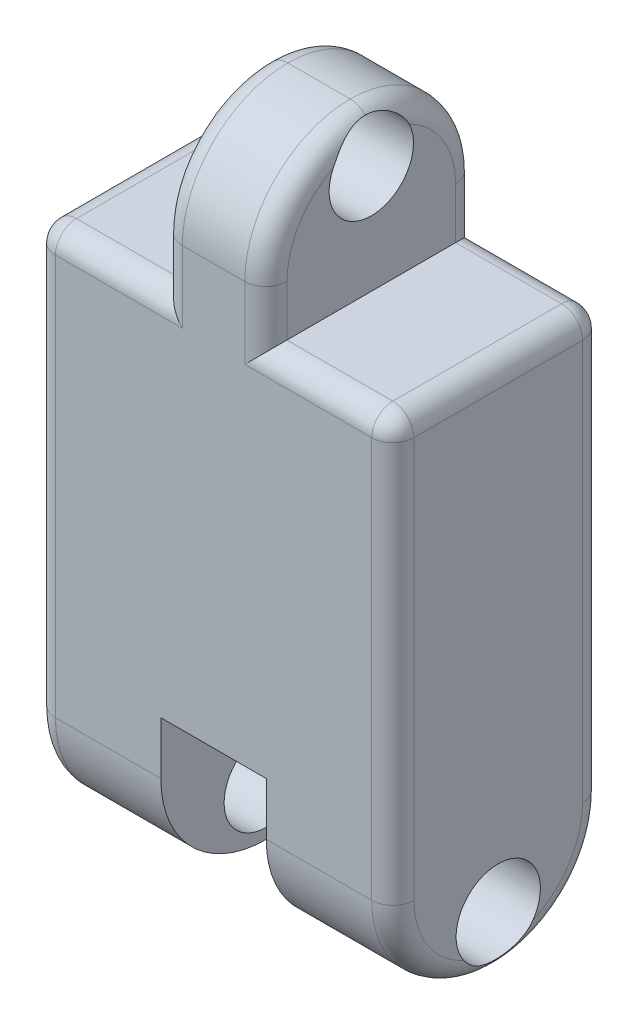
from build123d import *

# Parameters (mm, degrees)
BOSS_EXTRUDE1_DEPTH    = 100
SKETCH2_W              = 50
SKETCH2_H              = 50
CUT_EXTRUDE1_DEPTH     = 239.382046304
FILLET1_R              = 50
CUT_EXTRUDE2_DEPTH     = 25
SKETCH7_R              = 20
CUT_EXTRUDE3_DEPTH     = 281.180299093
FILLET2_R              = 50
CUT_EXTRUDE6_START     = -125
CUT_EXTRUDE6_OUTLINE_W = 50
CUT_EXTRUDE6_OUTLINE_H = 6.698729811
CUT_EXTRUDE6_DEPTH     = 50
CUT_EXTRUDE7_DEPTH     = 25
FILLET3_R              = 10
SKETCH11_W             = 50
SKETCH11_H             = 25
CUT_EXTRUDE8_DEPTH     = 99
BOSS_EXTRUDE7_DEPTH    = 0.1
FILLET4_R              = 10
FILLET5_R              = 10
SKETCH14_R             = 20
CUT_EXTRUDE9_DEPTH     = 249.348646185


with BuildPart() as part:
    # Sketch1 → Boss-Extrude1 (new body)
    with BuildSketch(Plane.XY):
        Polygon((-24.8, 125), (-24.8, 199), (24.8, 199), (24.8, 125), (85, 125), (85, -125), (-85, -125), (-85, 125), align=None)
    extrude(amount=-BOSS_EXTRUDE1_DEPTH)

    # Sketch2 → Cut-Extrude1 (cut, through all)
    with BuildSketch(Plane.XY):
        with Locations((0, -125)):
            Rectangle(SKETCH2_W, SKETCH2_H)
    extrude(amount=-CUT_EXTRUDE1_DEPTH, mode=Mode.SUBTRACT)

    # Fillet1
    fillet1_edges = [part.edges().sort_by_distance(p)[0] for p in [
        (0, 199, -100),
        (0, 199, 0),
    ]]
    fillet(fillet1_edges, radius=FILLET1_R - 0.0001)  # a hair under: the kernel refuses the full size

    # Sketch6 → Cut-Extrude2 (cut, symmetric)
    with BuildSketch(Plane(origin=(0, 0, 0), x_dir=(0, 0, -1), z_dir=(1, 0, 0))):
        with BuildLine():
            Line((100, -100), (0, -100))
            ThreePointArc((0, -100), (50, -50), (100, -100))
        make_face()
    extrude(amount=CUT_EXTRUDE2_DEPTH, both=True, mode=Mode.SUBTRACT)

    # Sketch7 → Cut-Extrude3 (cut, through all)
    with BuildSketch(Plane.ZY.offset(85)):
        with Locations(Location((-50, -100, 0), (0, 0, 270))):
            Circle(SKETCH7_R)
    extrude(amount=-CUT_EXTRUDE3_DEPTH, mode=Mode.SUBTRACT)

    # Fillet2
    fillet2_edges = [part.edges().sort_by_distance(p)[0] for p in [
        (-55, -125, -100),
        (-55, -125, 0),
    ]]
    fillet(fillet2_edges, radius=FILLET2_R - 0.0001)  # a hair under: the kernel refuses the full size

    # Cut-Extrude6: read off the stored shape, not the designer's step
    # Cut-Extrude6 outline → Cut-Extrude6 (cut)
    with BuildSketch(Plane(origin=(0, 0, 0), x_dir=(1, 0, 0), z_dir=(0, 1, 0)).offset(CUT_EXTRUDE6_START)):
        with Locations((0, 96.650635095)):
            Rectangle(CUT_EXTRUDE6_OUTLINE_W, CUT_EXTRUDE6_OUTLINE_H)
        with Locations((0, 3.349364906)):
            Rectangle(CUT_EXTRUDE6_OUTLINE_W, CUT_EXTRUDE6_OUTLINE_H)
    extrude(amount=CUT_EXTRUDE6_DEPTH, mode=Mode.SUBTRACT)

    # Sketch10 → Cut-Extrude7 (cut, symmetric)
    with BuildSketch(Plane(origin=(0, 0, 0), x_dir=(0, 0, -1), z_dir=(1, 0, 0))):
        with BuildLine():
            Line((0, -75), (100, -75))
            ThreePointArc((100, -75), (50, -61.611517322), (0, -75))
        make_face()
    extrude(amount=CUT_EXTRUDE7_DEPTH, both=True, mode=Mode.SUBTRACT)

    # Fillet3
    # the kernel refuses this fillet: 10 mm, written as the material it takes off along each edge
    with BuildSketch(Plane(origin=(24.8, 149.0001, -100), x_dir=(0, 0, 1), z_dir=(0, -1, 0)), Plane(origin=(-24.8, 125, 0), x_dir=(1, 0, 0), z_dir=(0, 1, 0)), Plane(origin=(-24.8, 125, -100), x_dir=(0, 0, 1), z_dir=(0, 1, 0)), Plane(origin=(24.8, 149.0001, 0), x_dir=(-1, 0, 0), z_dir=(0, -1, 0))) as fillet3_piece_1:
        with BuildLine():
            CenterArc((FILLET3_R, FILLET3_R), FILLET3_R, 180, 90)
            Line((0, FILLET3_R), (0, 0))
            Line((0, 0), (FILLET3_R, 0))
        make_face()
    extrude(amount=24.0001, mode=Mode.SUBTRACT)
    with BuildSketch(Plane(origin=(24.8, 125, 0), x_dir=(0, -1, 0), z_dir=(1, 0, 0)), Plane(origin=(-110, 125, -100), x_dir=(0, 0, 1), z_dir=(1, 0, 0)), Plane(origin=(24.8, 125, -100), x_dir=(0, 0, 1), z_dir=(1, 0, 0)), Plane(origin=(-110, 125, 0), x_dir=(0, -1, 0), z_dir=(1, 0, 0))) as fillet3_piece_2:
        with BuildLine():
            CenterArc((FILLET3_R, FILLET3_R), FILLET3_R, 180, 90)
            Line((0, FILLET3_R), (0, 0))
            Line((0, 0), (FILLET3_R, 0))
        make_face()
    extrude(amount=85.2, mode=Mode.SUBTRACT)
    with BuildSketch(Plane(origin=(-85, -75.0001, -100), x_dir=(0, 0, 1), z_dir=(0, 1, 0)), Plane(origin=(85, 150, 0), x_dir=(-1, 0, 0), z_dir=(0, -1, 0)), Plane(origin=(85, 150, -100), x_dir=(0, 0, 1), z_dir=(0, -1, 0)), Plane(origin=(-85, -75.0001, 0), x_dir=(1, 0, 0), z_dir=(0, 1, 0))) as fillet3_piece_3:
        with BuildLine():
            CenterArc((FILLET3_R, FILLET3_R), FILLET3_R, 180, 90)
            Line((0, FILLET3_R), (0, 0))
            Line((0, 0), (FILLET3_R, 0))
        make_face()
    extrude(amount=225.0001, mode=Mode.SUBTRACT)
    with BuildSketch(Plane(origin=(-24.8, 149.0001, -49.9999), x_dir=(0, 1, 0), z_dir=(0, 0, -1))) as fillet3_piece_4:
        with BuildLine():
            CenterArc((49.9999 - FILLET3_R, FILLET3_R), FILLET3_R, 270, 90)
            Line((49.9999 - FILLET3_R, 0), (49.9999, 0))
            Line((49.9999, 0), (49.9999, FILLET3_R))
        make_face()
    revolve(axis=Axis((-24.8, 149.0001, -49.9999), (1, 0, 0)), revolution_arc=90, mode=Mode.SUBTRACT)
    with BuildSketch(Plane(origin=(-24.8, 149.0001, -50.0001), x_dir=(0, 1, 0), z_dir=(0, 0, 1))) as fillet3_piece_5:
        with BuildLine():
            CenterArc((49.9999 - FILLET3_R, -FILLET3_R), FILLET3_R, 0, 90)
            Line((49.9999, -FILLET3_R), (49.9999, 0))
            Line((49.9999, 0), (49.9999 - FILLET3_R, 0))
        make_face()
    revolve(axis=Axis((-24.8, 149.0001, -50.0001), (-1, 0, 0)), revolution_arc=90, mode=Mode.SUBTRACT)
    with BuildSketch(Plane(origin=(24.8, 149.0001, -49.9999), x_dir=(0, 1, 0), z_dir=(0, 0, -1))) as fillet3_piece_6:
        with BuildLine():
            CenterArc((49.9999 - FILLET3_R, -FILLET3_R), FILLET3_R, 0, 90)
            Line((49.9999, -FILLET3_R), (49.9999, 0))
            Line((49.9999, 0), (49.9999 - FILLET3_R, 0))
        make_face()
    revolve(axis=Axis((24.8, 149.0001, -49.9999), (1, 0, 0)), revolution_arc=90, mode=Mode.SUBTRACT)
    with BuildSketch(Plane(origin=(24.8, 149.0001, -50.0001), x_dir=(0, 1, 0), z_dir=(0, 0, 1))) as fillet3_piece_7:
        with BuildLine():
            CenterArc((49.9999 - FILLET3_R, FILLET3_R), FILLET3_R, 270, 90)
            Line((49.9999, FILLET3_R), (49.9999, 0))
            Line((49.9999, 0), (49.9999 - FILLET3_R, 0))
        make_face()
    revolve(axis=Axis((24.8, 149.0001, -50.0001), (-1, 0, 0)), revolution_arc=90, mode=Mode.SUBTRACT)
    with BuildSketch(Plane(origin=(85, -75.0001, -49.9999), x_dir=(0, 0, 1), z_dir=(0, 1, 0))) as fillet3_piece_8:
        with BuildLine():
            CenterArc((49.9999 - FILLET3_R, -FILLET3_R), FILLET3_R, 360, 90)
            Line((49.9999, -FILLET3_R), (49.9999, 0))
            Line((49.9999, 0), (49.9999 - FILLET3_R, 0))
        make_face()
    revolve(axis=Axis((85, -75.0001, -49.9999), (1, 0, 0)), revolution_arc=90, mode=Mode.SUBTRACT)
    with BuildSketch(Plane(origin=(85, -75.0001, -50.0001), x_dir=(0, 0, -1), z_dir=(0, 1, 0))) as fillet3_piece_9:
        with BuildLine():
            CenterArc((49.9999 - FILLET3_R, FILLET3_R), FILLET3_R, 270, 90)
            Line((49.9999, FILLET3_R), (49.9999, 0))
            Line((49.9999, 0), (49.9999 - FILLET3_R, 0))
        make_face()
    revolve(axis=Axis((85, -75.0001, -50.0001), (-1, 0, 0)), revolution_arc=90, mode=Mode.SUBTRACT)
    with BuildSketch(Plane(origin=(-85, -75.0001, -49.9999), x_dir=(0, 0, 1), z_dir=(0, 1, 0))) as fillet3_piece_10:
        with BuildLine():
            CenterArc((49.9999 - FILLET3_R, FILLET3_R), FILLET3_R, 270, 90)
            Line((49.9999, FILLET3_R), (49.9999, 0))
            Line((49.9999, 0), (49.9999 - FILLET3_R, 0))
        make_face()
    revolve(axis=Axis((-85, -75.0001, -49.9999), (1, 0, 0)), revolution_arc=90, mode=Mode.SUBTRACT)
    with BuildSketch(Plane(origin=(-85, -75.0001, -50.0001), x_dir=(0, 0, -1), z_dir=(0, 1, 0))) as fillet3_piece_11:
        with BuildLine():
            CenterArc((49.9999 - FILLET3_R, -FILLET3_R), FILLET3_R, 0, 90)
            Line((49.9999, -FILLET3_R), (49.9999, 0))
            Line((49.9999, 0), (49.9999 - FILLET3_R, 0))
        make_face()
    revolve(axis=Axis((-85, -75.0001, -50.0001), (-1, 0, 0)), revolution_arc=90, mode=Mode.SUBTRACT)
    with BuildSketch(Plane(origin=(-85, -125, -49.9999), x_dir=(0, 1, 0), z_dir=(0, 0, -1)), Plane(origin=(24.8, 199, -49.9999), x_dir=(0, -1, 0), z_dir=(0, 0, -1))) as fillet3_piece_12:
        with BuildLine():
            CenterArc((FILLET3_R, FILLET3_R), FILLET3_R, 180, 90)
            Line((0, FILLET3_R), (0, 0))
            Line((0, 0), (FILLET3_R, 0))
        make_face()
    extrude(amount=0.0002, mode=Mode.SUBTRACT)
    with BuildSketch(Plane(origin=(85, -125, -49.9999), x_dir=(0, 1, 0), z_dir=(0, 0, -1)), Plane(origin=(-24.8, 199, -49.9999), x_dir=(0, -1, 0), z_dir=(0, 0, -1))) as fillet3_piece_13:
        with BuildLine():
            CenterArc((FILLET3_R, -FILLET3_R), FILLET3_R, 90, 90)
            Line((0, -FILLET3_R), (0, 0))
            Line((0, 0), (FILLET3_R, 0))
        make_face()
    extrude(amount=0.0002, mode=Mode.SUBTRACT)
    with BuildSketch(Plane(origin=(-0.2, 125, -100), x_dir=(0, 0, 1), z_dir=(1, 0, 0))) as fillet3_piece_14a_section:
        with BuildLine():
            CenterArc((FILLET3_R, FILLET3_R), FILLET3_R, 180, 90)
            Line((0, FILLET3_R), (0, 0))
            Line((0, 0), (FILLET3_R, 0))
        make_face()
    fillet3_piece_14a = extrude(amount=110.2, mode=Mode.PRIVATE)
    fillet3_piece_14a = split(fillet3_piece_14a, bisect_by=Plane(origin=(24.8, 125, -100), z_dir=(-1, 0, 0)), keep=Keep.TOP, mode=Mode.PRIVATE)
    with BuildSketch(Plane(origin=(24.8, 149.0001, -100), x_dir=(0, 0, 1), z_dir=(0, -1, 0))) as fillet3_piece_14b_section:
        with BuildLine():
            CenterArc((FILLET3_R, FILLET3_R), FILLET3_R, 180, 90)
            Line((0, FILLET3_R), (0, 0))
            Line((0, 0), (FILLET3_R, 0))
        make_face()
    fillet3_piece_14b = extrude(amount=49.0001, mode=Mode.PRIVATE)
    fillet3_piece_14b = split(fillet3_piece_14b, bisect_by=Plane(origin=(24.8, 125, -100), z_dir=(0, -1, 0)), keep=Keep.TOP, mode=Mode.PRIVATE)
    fillet3_piece_14 = fillet3_piece_14a & fillet3_piece_14b
    add(fillet3_piece_14, mode=Mode.SUBTRACT)
    with BuildSketch(Plane(origin=(-0.2, 125, 0), x_dir=(0, -1, 0), z_dir=(1, 0, 0))) as fillet3_piece_15a_section:
        with BuildLine():
            CenterArc((FILLET3_R, FILLET3_R), FILLET3_R, 180, 90)
            Line((0, FILLET3_R), (0, 0))
            Line((0, 0), (FILLET3_R, 0))
        make_face()
    fillet3_piece_15a = extrude(amount=110.2, mode=Mode.PRIVATE)
    fillet3_piece_15a = split(fillet3_piece_15a, bisect_by=Plane(origin=(24.8, 125, 0), z_dir=(-1, 0, 0)), keep=Keep.TOP, mode=Mode.PRIVATE)
    with BuildSketch(Plane(origin=(24.8, 149.0001, 0), x_dir=(-1, 0, 0), z_dir=(0, -1, 0))) as fillet3_piece_15b_section:
        with BuildLine():
            CenterArc((FILLET3_R, FILLET3_R), FILLET3_R, 180, 90)
            Line((0, FILLET3_R), (0, 0))
            Line((0, 0), (FILLET3_R, 0))
        make_face()
    fillet3_piece_15b = extrude(amount=49.0001, mode=Mode.PRIVATE)
    fillet3_piece_15b = split(fillet3_piece_15b, bisect_by=Plane(origin=(24.8, 125, 0), z_dir=(0, -1, 0)), keep=Keep.TOP, mode=Mode.PRIVATE)
    fillet3_piece_15 = fillet3_piece_15a & fillet3_piece_15b
    add(fillet3_piece_15, mode=Mode.SUBTRACT)
    with BuildSketch(Plane(origin=(-24.8, 100, -100), x_dir=(0, 0, 1), z_dir=(0, 1, 0))) as fillet3_piece_16a_section:
        with BuildLine():
            CenterArc((FILLET3_R, FILLET3_R), FILLET3_R, 180, 90)
            Line((0, FILLET3_R), (0, 0))
            Line((0, 0), (FILLET3_R, 0))
        make_face()
    fillet3_piece_16a = extrude(amount=49.0001, mode=Mode.PRIVATE)
    fillet3_piece_16a = split(fillet3_piece_16a, bisect_by=Plane(origin=(-24.8, 125, -100), z_dir=(0, -1, 0)), keep=Keep.TOP, mode=Mode.PRIVATE)
    with BuildSketch(Plane(origin=(-110, 125, -100), x_dir=(0, 0, 1), z_dir=(1, 0, 0))) as fillet3_piece_16b_section:
        with BuildLine():
            CenterArc((FILLET3_R, FILLET3_R), FILLET3_R, 180, 90)
            Line((0, FILLET3_R), (0, 0))
            Line((0, 0), (FILLET3_R, 0))
        make_face()
    fillet3_piece_16b = extrude(amount=110.2, mode=Mode.PRIVATE)
    fillet3_piece_16b = split(fillet3_piece_16b, bisect_by=Plane(origin=(-24.8, 125, -100), z_dir=(1, 0, 0)), keep=Keep.TOP, mode=Mode.PRIVATE)
    fillet3_piece_16 = fillet3_piece_16a & fillet3_piece_16b
    add(fillet3_piece_16, mode=Mode.SUBTRACT)
    with BuildSketch(Plane(origin=(-24.8, 100, 0), x_dir=(1, 0, 0), z_dir=(0, 1, 0))) as fillet3_piece_17a_section:
        with BuildLine():
            CenterArc((FILLET3_R, FILLET3_R), FILLET3_R, 180, 90)
            Line((0, FILLET3_R), (0, 0))
            Line((0, 0), (FILLET3_R, 0))
        make_face()
    fillet3_piece_17a = extrude(amount=49.0001, mode=Mode.PRIVATE)
    fillet3_piece_17a = split(fillet3_piece_17a, bisect_by=Plane(origin=(-24.8, 125, 0), z_dir=(0, -1, 0)), keep=Keep.TOP, mode=Mode.PRIVATE)
    with BuildSketch(Plane(origin=(-110, 125, 0), x_dir=(0, -1, 0), z_dir=(1, 0, 0))) as fillet3_piece_17b_section:
        with BuildLine():
            CenterArc((FILLET3_R, FILLET3_R), FILLET3_R, 180, 90)
            Line((0, FILLET3_R), (0, 0))
            Line((0, 0), (FILLET3_R, 0))
        make_face()
    fillet3_piece_17b = extrude(amount=110.2, mode=Mode.PRIVATE)
    fillet3_piece_17b = split(fillet3_piece_17b, bisect_by=Plane(origin=(-24.8, 125, 0), z_dir=(1, 0, 0)), keep=Keep.TOP, mode=Mode.PRIVATE)
    fillet3_piece_17 = fillet3_piece_17a & fillet3_piece_17b
    add(fillet3_piece_17, mode=Mode.SUBTRACT)

    # Sketch11 → Cut-Extrude8 (cut)
    with BuildSketch(Plane.XY):
        with Locations((0, -62.5)):
            Rectangle(SKETCH11_W, SKETCH11_H)
    extrude(amount=-CUT_EXTRUDE8_DEPTH, mode=Mode.SUBTRACT)

    # Fillet5
    # the kernel refuses this fillet: 10 mm, written as the material it takes off along each edge
    with BuildSketch(Plane(origin=(75, 115, -10), x_dir=(0, 1, 0), z_dir=(1, 0, 0))) as fillet5_piece_1_section:
        Polygon((0, 0), (FILLET5_R, 0), (FILLET5_R, FILLET5_R), (0, FILLET5_R), align=None)
    fillet5_piece_1 = extrude(amount=FILLET5_R, mode=Mode.PRIVATE)
    fillet5_piece_1 = fillet5_piece_1 - Plane(origin=(75, 115, -10), x_dir=(0, -0.7071067811865475, -0.7071067811865475), z_dir=(1, 0, 0)) * Sphere(FILLET5_R, mode=Mode.PRIVATE)
    add(fillet5_piece_1, mode=Mode.SUBTRACT)
    with BuildSketch(Plane(origin=(75, 115, -90), x_dir=(0, 1, 0), z_dir=(1, 0, 0))) as fillet5_piece_2_section:
        Polygon((0, 0), (FILLET5_R, 0), (FILLET5_R, -FILLET5_R), (0, -FILLET5_R), align=None)
    fillet5_piece_2 = extrude(amount=FILLET5_R, mode=Mode.PRIVATE)
    fillet5_piece_2 = fillet5_piece_2 - Plane(origin=(75, 115, -90), x_dir=(0, -0.7071067811865475, 0.7071067811865475), z_dir=(1, 0, 0)) * Sphere(FILLET5_R, mode=Mode.PRIVATE)
    add(fillet5_piece_2, mode=Mode.SUBTRACT)
    with BuildSketch(Plane(origin=(-75, 115, -90), x_dir=(0, 1, 0), z_dir=(-1, 0, 0))) as fillet5_piece_3_section:
        Polygon((0, 0), (FILLET5_R, 0), (FILLET5_R, FILLET5_R), (0, FILLET5_R), align=None)
    fillet5_piece_3 = extrude(amount=FILLET5_R, mode=Mode.PRIVATE)
    fillet5_piece_3 = fillet5_piece_3 - Plane(origin=(-75, 115, -90), x_dir=(0, -0.7071067811865475, 0.7071067811865475), z_dir=(-1, 0, 0)) * Sphere(FILLET5_R, mode=Mode.PRIVATE)
    add(fillet5_piece_3, mode=Mode.SUBTRACT)
    with BuildSketch(Plane(origin=(-75, 115, -10), x_dir=(0, 1, 0), z_dir=(-1, 0, 0))) as fillet5_piece_4_section:
        Polygon((0, 0), (FILLET5_R, 0), (FILLET5_R, -FILLET5_R), (0, -FILLET5_R), align=None)
    fillet5_piece_4 = extrude(amount=FILLET5_R, mode=Mode.PRIVATE)
    fillet5_piece_4 = fillet5_piece_4 - Plane(origin=(-75, 115, -10), x_dir=(0, -0.7071067811865475, -0.7071067811865475), z_dir=(-1, 0, 0)) * Sphere(FILLET5_R, mode=Mode.PRIVATE)
    add(fillet5_piece_4, mode=Mode.SUBTRACT)
    with BuildSketch(Plane(origin=(85, 125, -10), x_dir=(0, -1, 0), z_dir=(0, 0, -1))) as fillet5_piece_5:
        with BuildLine():
            CenterArc((FILLET5_R, FILLET5_R), FILLET5_R, 180, 90)
            Line((0, FILLET5_R), (0, 0))
            Line((0, 0), (FILLET5_R, 0))
        make_face()
    extrude(amount=80, mode=Mode.SUBTRACT)
    with BuildSketch(Plane(origin=(-85, 125, -10), x_dir=(0, -1, 0), z_dir=(0, 0, -1))) as fillet5_piece_6:
        with BuildLine():
            CenterArc((FILLET5_R, -FILLET5_R), FILLET5_R, 90, 90)
            Line((0, -FILLET5_R), (0, 0))
            Line((0, 0), (FILLET5_R, 0))
        make_face()
    extrude(amount=80, mode=Mode.SUBTRACT)

    # Sketch14 → Cut-Extrude9 (cut, through all)
    with BuildSketch(Plane(origin=(24.8, 0, 0), x_dir=(0, 0, -1), z_dir=(1, 0, 0))):
        with Locations(Location((50, 176, 0), (0, 0, 25.856016698))):
            Circle(SKETCH14_R)
    extrude(amount=-CUT_EXTRUDE9_DEPTH, mode=Mode.SUBTRACT)


with BuildPart() as body_2:
    # Sketch13 → Boss-Extrude7 (new body)
    with BuildSketch(Plane(origin=(0, 0, -100), x_dir=(-1, 0, 0), z_dir=(0, 0, -1))):
        Polygon((-25, -75), (-25, -105), (25.018802851, -105), (25, -75), align=None)
    extrude(amount=BOSS_EXTRUDE7_DEPTH)

    # Fillet4
    # the kernel refuses this fillet: 10 mm, written as the material it takes off along each edge
    with BuildSketch(Plane(origin=(-25.021013242, -108.526683302, -100.1), x_dir=(0, 0, 1), z_dir=(0.0006267615930631998, 0.9999998035849335, 0))) as fillet4_piece_1:
        with BuildLine():
            CenterArc((10, 1.410673598), FILLET4_R, 180, 8.109614456)
            Line((0, 1.410673598), (0, 0))
            Line((0, 0), (0.1, 0))
        make_face()
    extrude(amount=37.053373882, mode=Mode.SUBTRACT)
    with BuildSketch(Plane(origin=(25, -71.473316005, -100.1), x_dir=(0, 0, 1), z_dir=(0, -1, 0))) as fillet4_piece_2:
        with BuildLine():
            CenterArc((10, 1.410673598), FILLET4_R, 180, 8.109614456)
            Line((0, 1.410673598), (0, 0))
            Line((0, 0), (0.1, 0))
        make_face()
    extrude(amount=37.05336799, mode=Mode.SUBTRACT)
    with BuildSketch(Plane(origin=(28.526683995, -105, -100.1), x_dir=(0, 0, 1), z_dir=(-1, 0, 0))) as fillet4_piece_3:
        with BuildLine():
            CenterArc((10, 1.410673598), FILLET4_R, 180, 8.109614456)
            Line((0, 1.410673598), (0, 0))
            Line((0, 0), (0.1, 0))
        make_face()
    extrude(amount=57.072170841, mode=Mode.SUBTRACT)


solid = Compound([part.part, body_2.part])
